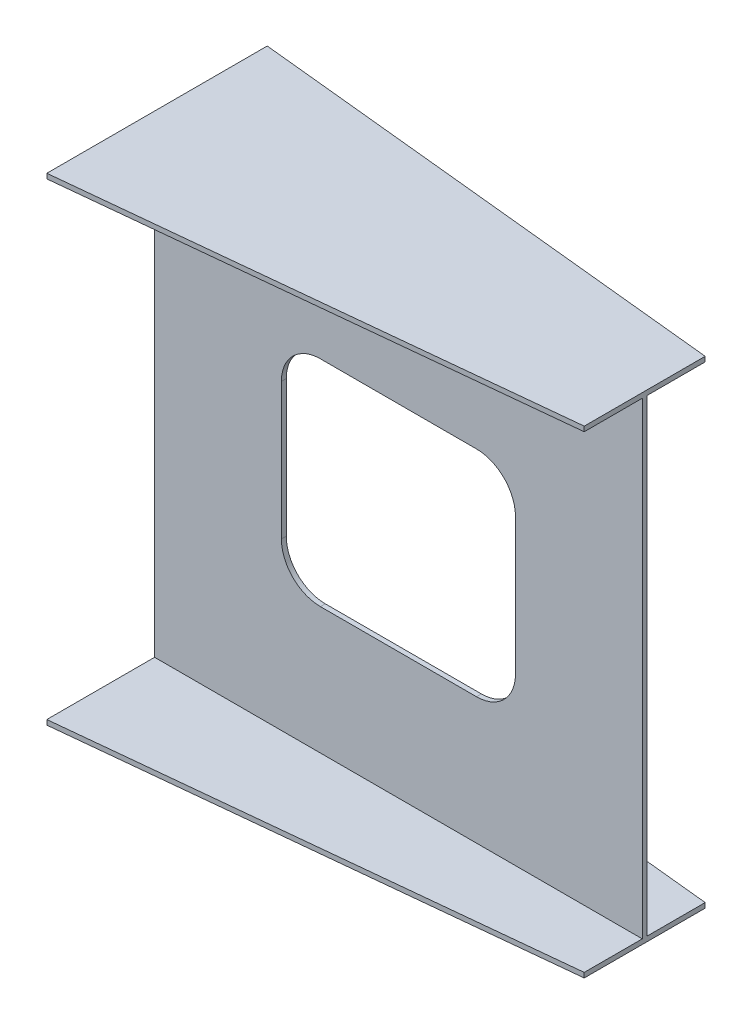
from build123d import *

# Parameters (mm, degrees)
CUT_EXTRUDE1_DEPTH = 1138.304269026


with BuildPart() as part:
    # Sketch1 → Loft l2 section 0
    with BuildSketch(Plane(origin=(0, 0, 0), x_dir=(0, 0, -1), z_dir=(1, 0, 0))):
        with BuildLine():
            Line((-231, 490), (221, 490))
            Line((221, 490), (221, 480))
            Line((221, 480), (0, 480))
            Line((0, 480), (0, -480))
            Line((0, -480), (221, -480))
            Line((221, -480), (221, -490))
            Line((221, -490), (-231, -490))
            Line((-231, -490), (-231, -480))
            Line((-231, -480), (-10, -480))
            Line((-10, -480), (-10, 480))
            Line((-10, 480), (-231, 480))
            Line((-231, 480), (-231, 490))
        make_face()
    # Sketch4 → Loft l2 section 1
    with BuildSketch(Plane(origin=(1000, 0, -1000), x_dir=(0, 0, 1), z_dir=(-1, 0, 0))):
        with BuildLine():
            Line((881, 490), (1129, 490))
            Line((1129, 490), (1129, 480))
            Line((1129, 480), (1010, 480))
            Line((1010, 480), (1010, -480))
            Line((1010, -480), (1129, -480))
            Line((1129, -480), (1129, -490))
            Line((1129, -490), (881, -490))
            Line((881, -490), (881, -480))
            Line((881, -480), (1000, -480))
            Line((1000, -480), (1000, 480))
            Line((1000, 480), (881, 480))
            Line((881, 480), (881, 490))
        make_face()
    loft()

    # Sketch6 → Cut-Extrude1 (cut, through all)
    with BuildSketch(Plane.XY.offset(10)):
        with BuildLine():
            Line((340, -220), (660, -220))
            ThreePointArc((660, -220), (716.568542495, -196.568542495), (740, -140))
            Line((740, -140), (740, 140))
            ThreePointArc((740, 140), (716.568542495, 196.568542495), (660, 220))
            Line((660, 220), (340, 220))
            ThreePointArc((340, 220), (283.431457505, 196.568542495), (260, 140))
            Line((260, 140), (260, -140))
            ThreePointArc((260, -140), (283.431457505, -196.568542495), (340, -220))
        make_face()
    extrude(amount=-CUT_EXTRUDE1_DEPTH, mode=Mode.SUBTRACT)


solid = part.part
